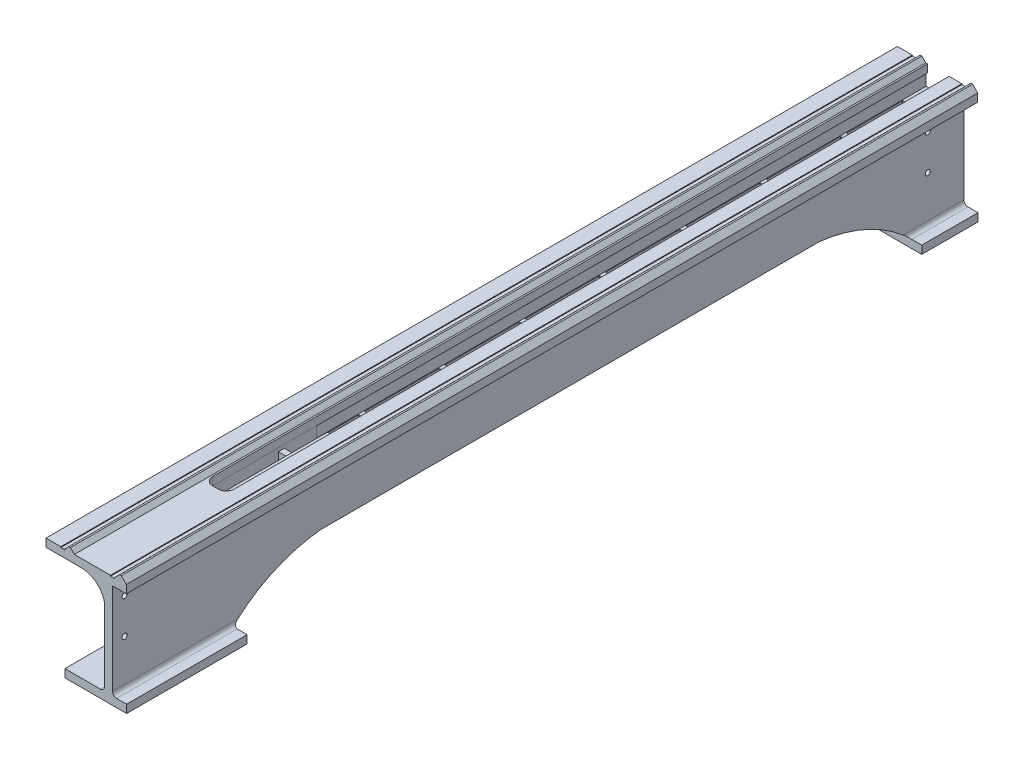
from build123d import *

# Parameters (mm, degrees)
BOSS_EXTRUDE1_DEPTH         = 1060
CUT_EXTRUDE1_DEPTH          = 800
SKETCH5_W                   = 10.426623187
SKETCH5_H                   = 125.292137731
BOSS_EXTRUDE2_DEPTH         = 950
SKETCH6_W                   = 7.435137382
SKETCH6_H                   = 64.029540506
BOSS_EXTRUDE3_DEPTH         = 50
LPATTERN1_COUNT             = 10
LPATTERN1_PITCH             = 100
CUT_EXTRUDE3_DEPTH          = 10
CUT_EXTRUDE3_DEPTH_BACK     = 100
CUT_EXTRUDE2_START          = -300
SKETCH3_W                   = 37.098457344
SKETCH3_H                   = 15
CUT_EXTRUDE2_DEPTH          = 1000
SKETCH7_W                   = 41.986295648
SKETCH7_H                   = 14.210937294
BOSS_EXTRUDE4_DEPTH         = 30
SKETCH8_R                   = 3.874254892
CUT_EXTRUDE4_DEPTH          = 30
SKETCH_1_R                  = 3.167509586
CUT_EXTRUDE_1_DEPTH         = 10
PATTERN_LINEAR_1_COUNT      = 2
PATTERN_LINEAR_1_PITCH      = 44
PATTERN_LINEAR_1_COUNT_DIR2 = 2
PATTERN_LINEAR_1_PITCH_DIR2 = 1000


with BuildPart() as part:
    # Sketch1 → Boss-Extrude1 (new body)
    with BuildSketch(Plane.XY):
        with BuildLine():
            Line((-31.555119126, 31.290150882), (-37.853807036, 37.718722311))
            Line((-37.853807036, 37.718722311), (-39.853807036, 37.718722311))
            Line((-39.853807036, 37.718722311), (-46.282378465, 31.420034401))
            Line((-46.282378465, 31.420034401), (-46.282378465, 30.420034401))
            Line((-46.282378465, 30.420034401), (-51.282378465, 30.420034401))
            Line((-51.282378465, 30.420034401), (-51.282378465, 31.420034401))
            Line((-51.282378465, 31.420034401), (-96.206307824, 31.420034401))
            Line((-96.206307824, 31.420034401), (-101.105287309, 36.420034401))
            Line((-101.105287309, 36.420034401), (-103.105287309, 36.420034401))
            Line((-103.105287309, 36.420034401), (-108.055034777, 31.470286932))
            Line((-108.055034777, 31.470286932), (-108.055034777, 30.420034401))
            Line((-108.055034777, 30.420034401), (-113.055034777, 30.420034401))
            Line((-113.055034777, 30.420034401), (-113.055034777, 31.420034401))
            Line((-113.055034777, 31.420034401), (-131.555034777, 31.420034401))
            Line((-131.555034777, 31.420034401), (-131.555034777, 21.420034401))
            Line((-131.555034777, 21.420034401), (-87.349569261, 21.420034401))
            ThreePointArc((-87.349569261, 21.420034401), (-68.862935324, 14.835575372), (-58.701074529, -1.95273366))
            Line((-58.701074529, -1.95273366), (-58.701074529, -92.579965599))
            ThreePointArc((-58.701074529, -92.579965599), (-60.165540623, -96.115499505), (-63.701074529, -97.579965599))
            Line((-63.701074529, -97.579965599), (-108.009983562, -97.579965599))
            Line((-108.009983562, -97.579965599), (-108.009983562, -107.579965599))
            Line((-108.009983562, -107.579965599), (-31.195424592, -107.579965599))
            Line((-31.195424592, -107.579965599), (-31.195424592, -97.579965599))
            Line((-31.195424592, -97.579965599), (-43.701074529, -97.579965599))
            ThreePointArc((-43.701074529, -97.579965599), (-47.236608435, -96.115499505), (-48.701074529, -92.579965599))
            Line((-48.701074529, -92.579965599), (-48.701074529, 21.290150882))
            Line((-48.701074529, 21.290150882), (-31.555119126, 21.290150882))
            Line((-31.555119126, 21.290150882), (-31.555119126, 31.290150882))
        make_face()
    extrude(amount=BOSS_EXTRUDE1_DEPTH)

    # Sketch2 → Cut-Extrude1 (cut)
    with BuildSketch(Plane(origin=(0, 20.764722339, 0), x_dir=(1, 0, 0), z_dir=(0, 1, 0))):
        with BuildLine():
            Line((-84.170689991, 100), (-77.170689991, 100))
            ThreePointArc((-77.170689991, 100), (-70.099622179, 97.071067812), (-67.170689991, 90))
            Line((-67.170689991, 90), (-67.170689991, -890))
            ThreePointArc((-67.170689991, -890), (-70.099622179, -897.071067812), (-77.170689991, -900))
            Line((-77.170689991, -900), (-84.170689991, -900))
            ThreePointArc((-84.170689991, -900), (-91.241757803, -897.071067812), (-94.170689991, -890))
            Line((-94.170689991, -890), (-94.170689991, 90))
            ThreePointArc((-94.170689991, 90), (-91.241757803, 97.071067812), (-84.170689991, 100))
        make_face()
    extrude(amount=CUT_EXTRUDE1_DEPTH, mode=Mode.SUBTRACT)

    # Sketch5 → Boss-Extrude2 (add)
    with BuildSketch(Plane(origin=(0, 0, 0), x_dir=(-1, 0, 0), z_dir=(0, 0, -1))):
        with Locations((100.133130522, -34.849417223)):
            Rectangle(SKETCH5_W, SKETCH5_H)
    extrude(amount=-BOSS_EXTRUDE2_DEPTH)

    # Sketch6 → Boss-Extrude3 (add)
    with BuildSketch(Plane.ZY.offset(105.346442115)):
        with Locations((3.717568691, -15.430068515)):
            Rectangle(SKETCH6_W, SKETCH6_H)
    boss_extrude3 = extrude(amount=-BOSS_EXTRUDE3_DEPTH)

    # LPattern1: Boss-Extrude3 ×10
    with Locations(*[(0, 0, i * LPATTERN1_PITCH) for i in range(1, LPATTERN1_COUNT)]):
        add(boss_extrude3)

    # Sketch4 → Cut-Extrude3 (cut, two sides: drawn at the far end of the back side and taken through both)
    with BuildSketch(Plane(origin=(-31.555119126, 0, 0), x_dir=(0, 0, -1), z_dir=(1, 0, 0)).offset(-CUT_EXTRUDE3_DEPTH_BACK)):
        with BuildLine():
            Line((-910, -97.579965599), (-910, -107.579965599))
            Line((-910, -107.579965599), (-910, -177.956634241))
            Line((-910, -177.956634241), (-70, -177.956634241))
            Line((-70, -177.956634241), (-70, -97.579965599))
            ThreePointArc((-70, -97.579965599), (-121.056751887, -63.823667059), (-180.068799532, -47.579965599))
            Line((-180.068799532, -47.579965599), (-800, -47.579965599))
            ThreePointArc((-800, -47.579965599), (-859.23910305, -63.253938888), (-910, -97.579965599))
        make_face()
    extrude(amount=CUT_EXTRUDE3_DEPTH + CUT_EXTRUDE3_DEPTH_BACK, mode=Mode.SUBTRACT)

    # Sketch3 → Cut-Extrude2 (cut)
    with BuildSketch(Plane.XY.offset(1060).offset(CUT_EXTRUDE2_START)):
        with Locations((-77.250303201, 13.920034401)):
            Rectangle(SKETCH3_W, SKETCH3_H)
    extrude(amount=-CUT_EXTRUDE2_DEPTH, mode=Mode.SUBTRACT)

    # Sketch7 → Boss-Extrude4 (add)
    with BuildSketch(Plane(origin=(0, 0, 0), x_dir=(-1, 0, 0), z_dir=(0, 0, -1))):
        with Locations((78.756733265, -0.685434246)):
            Rectangle(SKETCH7_W, SKETCH7_H)
    extrude(amount=-BOSS_EXTRUDE4_DEPTH)

    # Sketch8 → Cut-Extrude4 (cut)
    with BuildSketch(Plane(origin=(0, 6.420034401, 0), x_dir=(1, 0, 0), z_dir=(0, 1, 0))):
        with Locations((-79.789069173, -14.972288239)):
            Circle(SKETCH8_R)
    extrude(amount=-CUT_EXTRUDE4_DEPTH, mode=Mode.SUBTRACT)

    # Эскиз1 → Вырез-Вытянуть1 (cut)
    with BuildSketch(Plane(origin=(-48.701074529, 0, 0), x_dir=(0, 0, -1), z_dir=(1, 0, 0))):
        with Locations((-45, 3.290150882)):
            Circle(SKETCH_1_R)
    cut_extrude_1 = extrude(amount=-CUT_EXTRUDE_1_DEPTH, mode=Mode.SUBTRACT)

    # Линейный массив1: Cut-Extrude 1 2 × 2
    with Locations(*[(0, -i * PATTERN_LINEAR_1_PITCH, j * PATTERN_LINEAR_1_PITCH_DIR2) for i in range(PATTERN_LINEAR_1_COUNT) for j in range(PATTERN_LINEAR_1_COUNT_DIR2) if (i, j) != (0, 0)]):
        add(cut_extrude_1, mode=Mode.SUBTRACT)


solid = part.part
